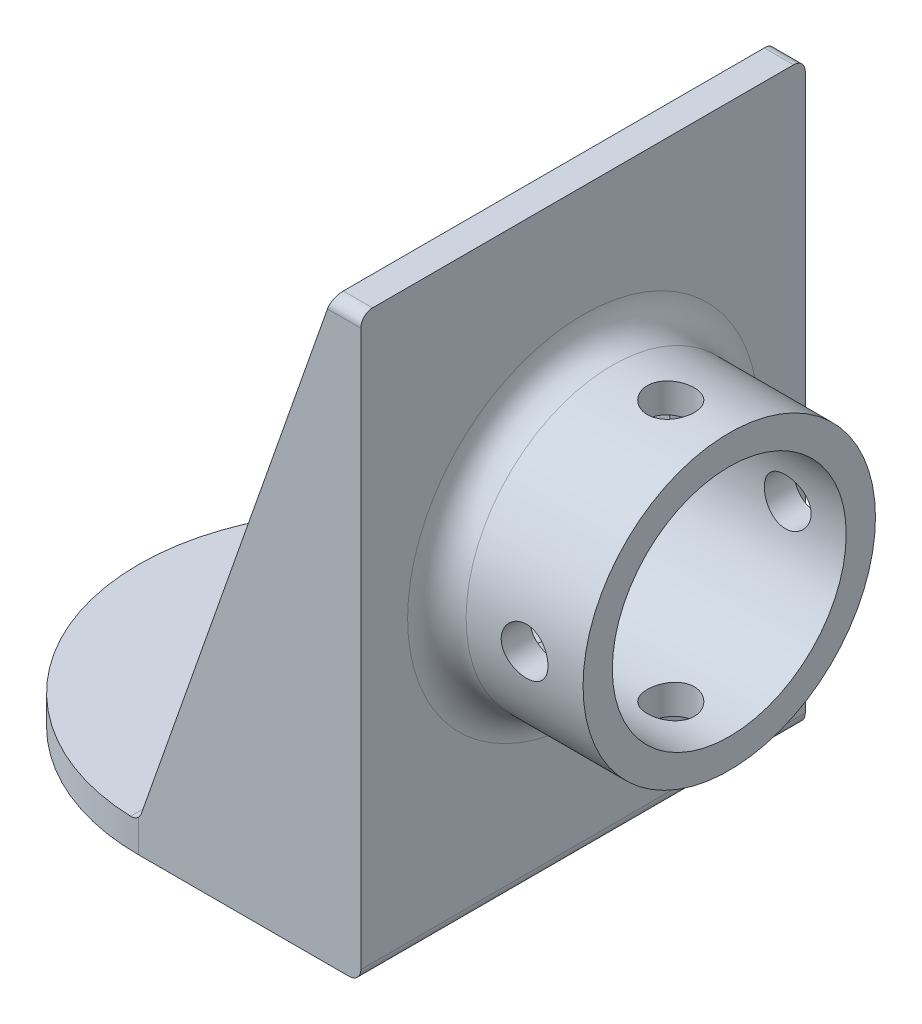
from build123d import *

# Parameters (mm, degrees)
EXTRUDE_1_DEPTH     = 76
FILLET_1_R          = 38
RIB_1_REACH         = 148.127
SKETCH_4_WALL_W     = 393.877609006
SKETCH_4_WALL_H     = 5
RIB_START           = -5
RIB_2_DEPTH         = 5
SKETCH_7_R          = 2.5
CUT_EXTRUDE_1_DEPTH = 10
FILLET_2_R          = 2
CHAMFER_1_SIZE      = 10
CHAMFER_1_SIZE2     = 5
FILLET_3_R          = 2
FILLET_4_R          = 2
SKETCH_8_R          = 20
CUT_EXTRUDE_2_DEPTH = 5
EXTRUDE_START       = 25
SKETCH_8_6_R        = 25
SKETCH_8_6_R_2      = 20
EXTRUDE_4_DEPTH     = 25
FILLET_5_R          = 5
SKETCH_13_R         = 4
CUT_EXTRUDE_3_DEPTH = 76
SKETCH_14_R         = 4
CUT_EXTRUDE_4_DEPTH = 76


with BuildPart() as part:
    # Эскиз3 → Бобышка-Вытянуть1 (new body)
    with BuildSketch(Plane.XY):
        Polygon((76, 0), (0, 0), (0, 5), (71, 5), (71, 99), (76, 99), align=None)
    extrude(amount=EXTRUDE_1_DEPTH)

    # Скругление1
    fillet_1_edges = [part.edges().sort_by_distance(p)[0] for p in [
        (0, 2.5, 0),
        (0, 2.5, 76),
    ]]
    fillet(fillet_1_edges, radius=FILLET_1_R - 0.0001)  # a hair under: the kernel refuses the full size

    # Эскиз4 wall → Ребро1 (add, up to next)
    with BuildSketch(Plane(origin=(54.5, 52, 76), x_dir=(-0.331244504731, -0.94354495287, 0), z_dir=(0.94354495287, -0.331244504731, 0)), mode=Mode.PRIVATE) as rib_1_sk1:
        with Locations((0, 2.5)):
            Rectangle(SKETCH_4_WALL_W, SKETCH_4_WALL_H)
    rib_1_tool1 = extrude(rib_1_sk1.sketch, amount=RIB_1_REACH, mode=Mode.PRIVATE) - part.part
    add(rib_1_tool1.solids().sort_by_distance((54.5, 52, 76))[0])

    # Ребро2: read off the stored shape, not the designer's step
    # Ребро2 outline → Ребро2 (add)
    with BuildSketch(Plane(origin=(0, 0, 0), x_dir=(-1, 0, 0), z_dir=(0, 0, -1)).offset(RIB_START)):
        Polygon((-38, 5), (-71, 99), (-71, 5), align=None)
    extrude(amount=RIB_2_DEPTH)

    # Эскиз7 → Вырез-Вытянуть1 (cut)
    with BuildSketch(Plane(origin=(0, 5, 0), x_dir=(1, 0, 0), z_dir=(0, 1, 0))):
        with Locations(Location((20, -38, 0), (0, 0, 180))):
            Circle(SKETCH_7_R)
        with Locations(Location((29, -22.411542732, 0), (0, 0, 180))):
            Circle(SKETCH_7_R)
        with Locations(Location((47, -22.411542732, 0), (0, 0, 180))):
            Circle(SKETCH_7_R)
        with Locations(Location((56, -38, 0), (0, 0, 180))):
            Circle(SKETCH_7_R)
        with Locations(Location((47, -53.588457268, 0), (0, 0, 180))):
            Circle(SKETCH_7_R)
        with Locations(Location((29, -53.588457268, 0), (0, 0, 180))):
            Circle(SKETCH_7_R)
    extrude(amount=-CUT_EXTRUDE_1_DEPTH, mode=Mode.SUBTRACT)

    # Скругление2
    fillet_2_edges = [part.edges().sort_by_distance(p)[0] for p in [
        (76, 0, 38),
    ]]
    fillet(fillet_2_edges, radius=FILLET_2_R)

    # Фаска1
    chamfer_1_edges = [part.edges().sort_by_distance(p)[0] for p in [
        (71, 5, 38),
    ]]
    chamfer_1_side = [part.faces().sort_by_distance(p)[0] for p in [
        (71, 52, 38),
    ]]
    chamfer(chamfer_1_edges, length=CHAMFER_1_SIZE, length2=CHAMFER_1_SIZE2, reference=chamfer_1_side[0])

    # Скругление3
    fillet_3_edges = [part.edges().sort_by_distance(p)[0] for p in [
        (38, 5, 73.5),
        (38, 5, 2.5),
    ]]
    fillet(fillet_3_edges, radius=FILLET_3_R)

    # Скругление4
    fillet_4_edges = [part.edges().sort_by_distance(p)[0] for p in [
        (73.5, 99, 76),
        (73.5, 99, 0),
    ]]
    fillet(fillet_4_edges, radius=FILLET_4_R)

    # Эскиз8 → Вырез-Вытянуть2 (cut)
    with BuildSketch(Plane(origin=(76, 0, 0), x_dir=(0, 0, -1), z_dir=(1, 0, 0))):
        with Locations((-38, 50)):
            Circle(SKETCH_8_R)
    extrude(amount=-CUT_EXTRUDE_2_DEPTH, mode=Mode.SUBTRACT)

    # Эскиз8<6> → Бобышка-Вытянуть4 (add)
    with BuildSketch(Plane(origin=(76, 0, 0), x_dir=(0, 0, -1), z_dir=(1, 0, 0)).offset(EXTRUDE_START)):
        with Locations(Location((-38, 50, 0), (0, 0, 180))):
            Circle(SKETCH_8_6_R)
        with Locations((-38, 50)):
            Circle(SKETCH_8_6_R_2, mode=Mode.SUBTRACT)
    extrude(amount=-EXTRUDE_4_DEPTH)

    # Скругление5
    fillet_5_edges = [part.edges().sort_by_distance(p)[0] for p in [
        (76, 50, 13),
    ]]
    fillet(fillet_5_edges, radius=FILLET_5_R)

    # Эскиз13 → Вырез-Вытянуть3 (cut)
    with BuildSketch(Plane(origin=(0, 0, 0), x_dir=(-1, 0, 0), z_dir=(0, 0, -1))):
        with Locations((-91, 50)):
            Circle(SKETCH_13_R)
    extrude(amount=-CUT_EXTRUDE_3_DEPTH, mode=Mode.SUBTRACT)

    # Эскиз14 → Вырез-Вытянуть4 (cut)
    with BuildSketch(Plane(origin=(0, 99, 0), x_dir=(1, 0, 0), z_dir=(0, 1, 0))):
        with Locations(Location((91, -38, 0), (0, 0, 270))):
            Circle(SKETCH_14_R)
    extrude(amount=-CUT_EXTRUDE_4_DEPTH, mode=Mode.SUBTRACT)


solid = part.part
